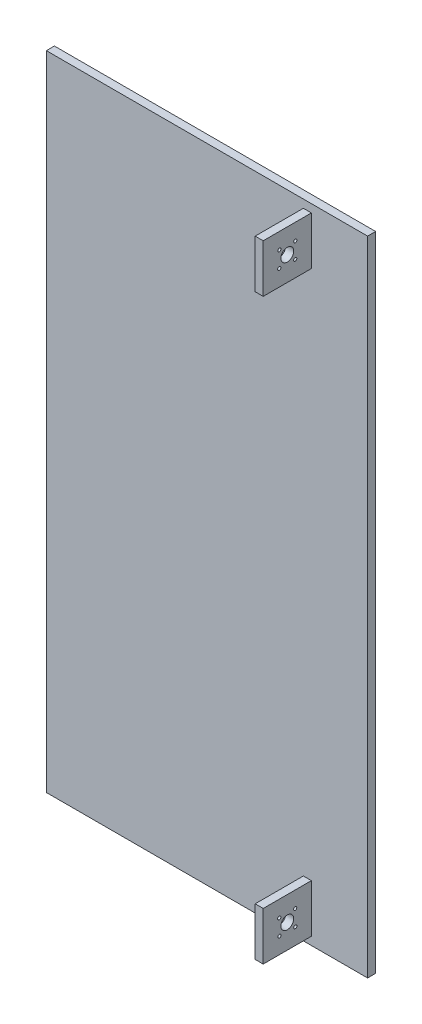
from build123d import *

# Parameters (mm, degrees)
ESQUISSE1_W             = 200
ESQUISSE1_H             = 400
BOSS_EXTRU_1_DEPTH      = 5
ESQUISSE2_W             = 5
ESQUISSE2_H             = 30
BOSS_EXTRU_2_DEPTH      = 30
ESQUISSE3_R             = 4
ENL_V_MAT_EXTRU_1_DEPTH = 262.629509039
ESQUISSE4_R             = 1
ENL_V_MAT_EXTRU_2_DEPTH = 259.505319094


with BuildPart() as part:
    # Esquisse1 → Boss.-Extru.1 (new body)
    with BuildSketch(Plane.XY):
        Rectangle(ESQUISSE1_W, ESQUISSE1_H)
    extrude(amount=BOSS_EXTRU_1_DEPTH)

    # Esquisse2 → Boss.-Extru.2 (add)
    with BuildSketch(Plane.XY.offset(5)):
        with Locations((62.5, 180)):
            Rectangle(ESQUISSE2_W, ESQUISSE2_H)
    boss_extru_2 = extrude(amount=BOSS_EXTRU_2_DEPTH)

    # Esquisse3 → Enlèv. mat.-Extru.1 (cut, symmetric)
    with BuildSketch(Plane(origin=(65, 0, 0), x_dir=(0, 0, -1), z_dir=(1, 0, 0))):
        with Locations((-20, 180)):
            Circle(ESQUISSE3_R)
    enl_v_mat_extru_1 = extrude(amount=ENL_V_MAT_EXTRU_1_DEPTH, both=True, mode=Mode.SUBTRACT)

    # Esquisse4 → Enlèv. mat.-Extru.2 (cut, symmetric)
    with BuildSketch(Plane.ZY.offset(-60)):
        with Locations((24.90636485, 184.992753144)):
            Circle(ESQUISSE4_R)
        with Locations((15.09363515, 175.007246856)):
            Circle(ESQUISSE4_R)
        with Locations((24.992753144, 175.09363515)):
            Circle(ESQUISSE4_R)
        with Locations((15.007246856, 184.90636485)):
            Circle(ESQUISSE4_R)
    enl_v_mat_extru_2 = extrude(amount=ENL_V_MAT_EXTRU_2_DEPTH, both=True, mode=Mode.SUBTRACT)

    # Symétrie1: Boss.-Extru.2, Enlèv. mat.-Extru.1, Enlèv. mat.-Extru.2 across plane
    add(boss_extru_2.mirror(Plane.ZX))
    add(enl_v_mat_extru_1.mirror(Plane.ZX), mode=Mode.SUBTRACT)
    add(enl_v_mat_extru_2.mirror(Plane.ZX), mode=Mode.SUBTRACT)


solid = part.part
